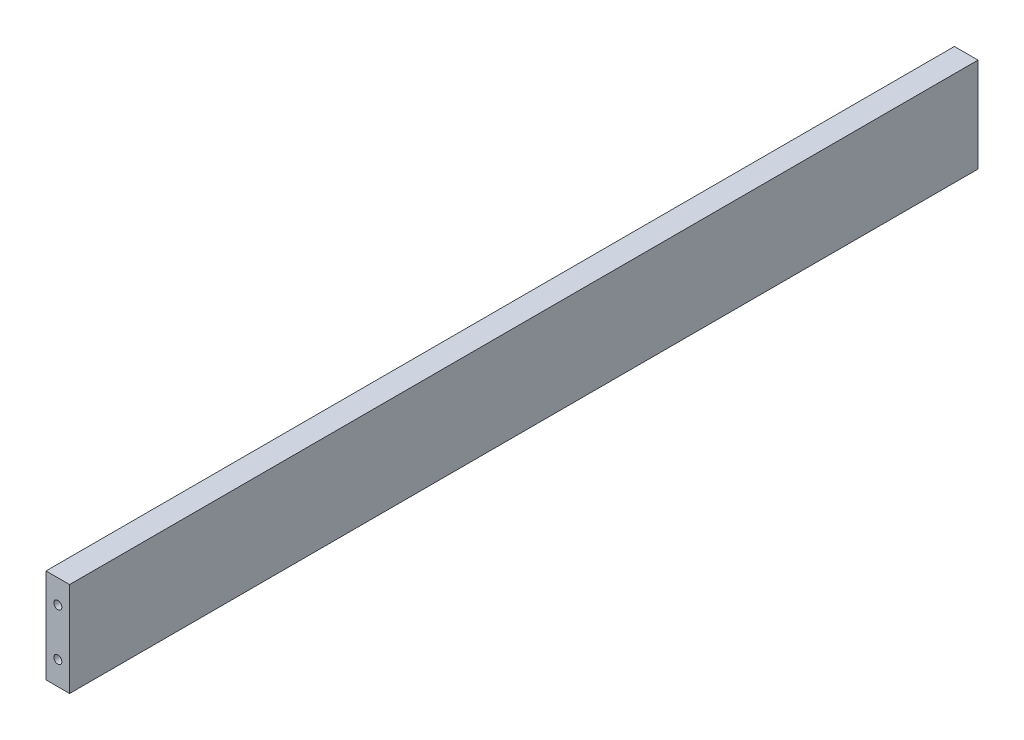
from build123d import *

# Parameters (mm, degrees)
SKETCH1_W             = 20
SKETCH1_H             = 80
BOSS_EXTRUDE1_DEPTH   = 770
M8_TAPPED_HOLE1_D     = 6.8
M8_TAPPED_HOLE1_DEPTH = 25.75
M8_TAPPED_HOLE1_TIP   = 2.042926105
M8_TAPPED_HOLE3_D     = 6.8
M8_TAPPED_HOLE3_DEPTH = 25.75
M8_TAPPED_HOLE3_TIP   = 2.042926105


with BuildPart() as part:
    # Sketch1 → Boss-Extrude1 (new body)
    with BuildSketch(Plane.XY):
        Rectangle(SKETCH1_W, SKETCH1_H)
    extrude(amount=-BOSS_EXTRUDE1_DEPTH)

    # M8 Tapped Hole1
    with Locations(Plane(origin=(0, 20, 0), x_dir=(1, 0, 0), z_dir=(0, 0, 1))):
        with Locations((0, 0), (0, -40)):
            Hole(M8_TAPPED_HOLE1_D / 2, depth=M8_TAPPED_HOLE1_DEPTH)
            with Locations((0, 0, -(M8_TAPPED_HOLE1_DEPTH + M8_TAPPED_HOLE1_TIP / 2))):  # 118° drill point
                Cone(0, M8_TAPPED_HOLE1_D / 2, M8_TAPPED_HOLE1_TIP, mode=Mode.SUBTRACT)

    # M8 Tapped Hole3
    with Locations(Plane(origin=(0, 20, -770), x_dir=(-1, 0, 0), z_dir=(0, 0, -1))):
        with Locations((0, 0), (0, -40)):
            Hole(M8_TAPPED_HOLE3_D / 2, depth=M8_TAPPED_HOLE3_DEPTH)
            with Locations((0, 0, -(M8_TAPPED_HOLE3_DEPTH + M8_TAPPED_HOLE3_TIP / 2))):  # 118° drill point
                Cone(0, M8_TAPPED_HOLE3_D / 2, M8_TAPPED_HOLE3_TIP, mode=Mode.SUBTRACT)


solid = part.part
